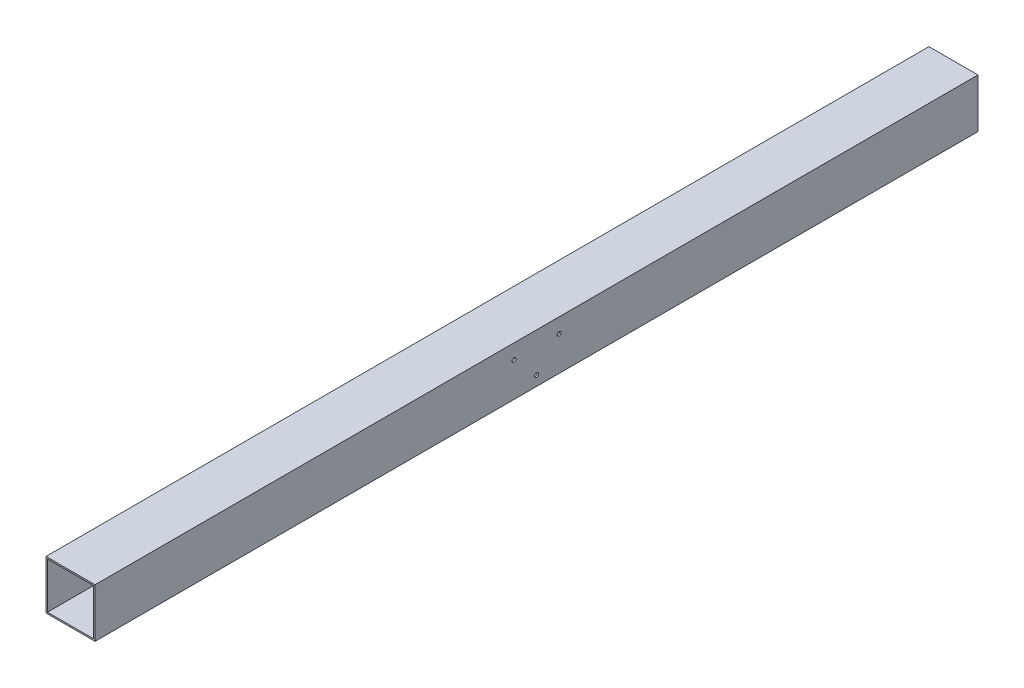
from build123d import *

# Parameters (mm, degrees)
SKETCH1_W           = 50
SKETCH1_H           = 50
SKETCH1_W_2         = 47
SKETCH1_H_2         = 47
BOSS_EXTRUDE1_DEPTH = 900
SKETCH2_R           = 2
CUT_EXTRUDE1_DEPTH  = 59


with BuildPart() as part:
    # Sketch1 → Boss-Extrude1 (new body)
    with BuildSketch(Plane.XY):
        Rectangle(SKETCH1_W, SKETCH1_H)
        Rectangle(SKETCH1_W_2, SKETCH1_H_2, mode=Mode.SUBTRACT)
    extrude(amount=BOSS_EXTRUDE1_DEPTH)

    # Sketch2 → Cut-Extrude1 (cut)
    with BuildSketch(Plane(origin=(25, 0, 0), x_dir=(0, 0, -1), z_dir=(1, 0, 0))):
        with Locations((-450, -15)):
            Circle(SKETCH2_R)
        with Locations((-427, 10)):
            Circle(SKETCH2_R)
        with Locations((-473, 10)):
            Circle(SKETCH2_R)
    extrude(amount=-CUT_EXTRUDE1_DEPTH, mode=Mode.SUBTRACT)


solid = part.part
